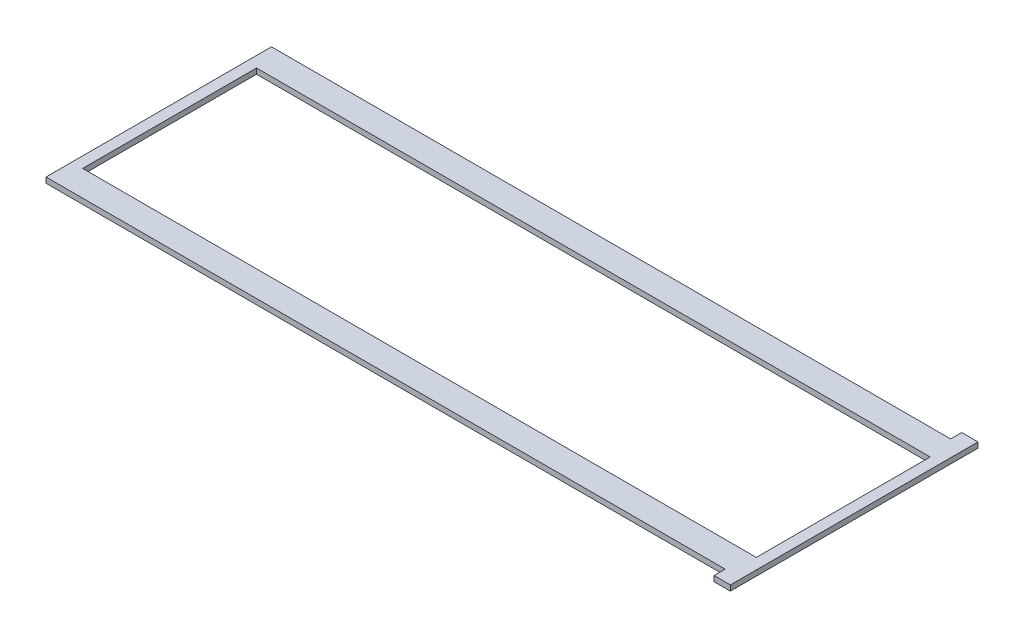
from build123d import *

# Parameters (mm, degrees)
SKETCH1_W           = 393.7
SKETCH1_H           = 101.6508
BOSS_EXTRUDE1_DEPTH = 3.175


with BuildPart() as part:
    # Sketch1 → Boss-Extrude1 (new body)
    with BuildSketch(Plane(origin=(0, 0, 0), x_dir=(1, 0, 0), z_dir=(0, 1, 0))):
        Polygon((193.675, -65.884425), (193.675, -72.361425), (203.2, -72.361425), (203.2, 72.361425), (193.675, 72.361425), (193.675, 65.884425), (-203.2, 65.884425), (-203.2, -65.884425), align=None)
        with Locations((0, -0.0254)):
            Rectangle(SKETCH1_W, SKETCH1_H, mode=Mode.SUBTRACT)
    extrude(amount=BOSS_EXTRUDE1_DEPTH)


solid = part.part
